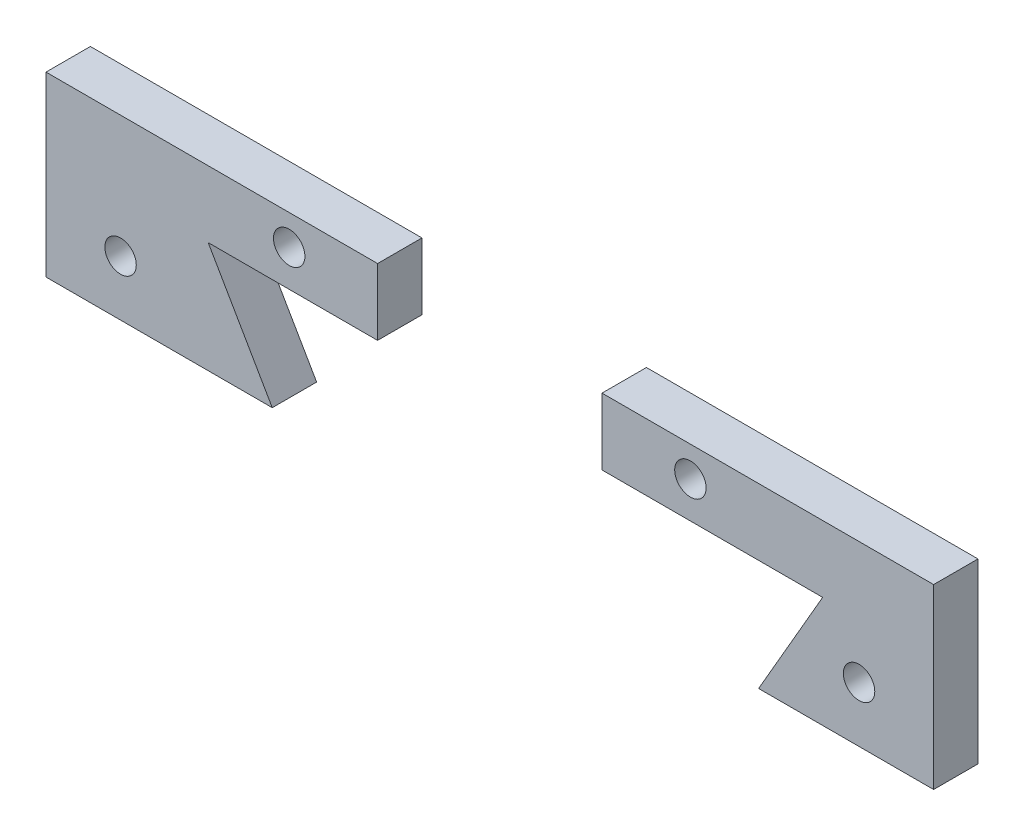
from build123d import *

# Parameters (mm, degrees)
BOSS_EXTRUDE1_DEPTH            = 6.35
BOSS_EXTRUDE1_2_DEPTH          = 6.35
SKETCH3_W                      = 2.2479
SKETCH3_H                      = 6.35
F_8_CLEARANCE_HOLE1_AT_2_COUNT = 2
F_8_CLEARANCE_HOLE1_AT_2_PITCH = 27.477896212
F_8_CLEARANCE_HOLE1_AT_3_COUNT = 2
F_8_CLEARANCE_HOLE1_AT_3_PITCH = 82.586748551
F_8_CLEARANCE_HOLE1_AT_4_COUNT = 2
F_8_CLEARANCE_HOLE1_AT_4_PITCH = 105.664


with BuildPart() as part:
    # Sketch1 → Boss-Extrude1 (new body)
    with BuildSketch(Plane.XY):
        Polygon((-31.127216058, 0), (-63.5, 0), (-63.5, 25.4), (-16.056336319, 25.4), (-16.056336319, 15.875), (-40.292651581, 15.875), align=None)
    extrude(amount=BOSS_EXTRUDE1_DEPTH)

    # Sketch3 → #8 Clearance Hole1 (revolve, cut)
    with BuildSketch(Plane(origin=(-52.832, 7.9375, 6.35), x_dir=(0, -1, 0), z_dir=(1, 0, 0))):
        with Locations((1.12395, 3.175)):
            Rectangle(SKETCH3_W, SKETCH3_H)
    f_8_clearance_hole1 = revolve(axis=Axis((-52.832, 7.9375, 12.7), (0, 0, -1)), mode=Mode.SUBTRACT)

    # #8 Clearance Hole1 at 2: #8 Clearance Hole1 ×2
    with Locations(*[Vector(0.8781603880307779, 0.4783663166378186, 0) * (i * F_8_CLEARANCE_HOLE1_AT_2_PITCH) for i in range(1, F_8_CLEARANCE_HOLE1_AT_2_COUNT)]):
        add(f_8_clearance_hole1, mode=Mode.SUBTRACT)


with BuildPart() as body_2:
    # Sketch1 → Boss-Extrude1 2 (new body)
    with BuildSketch(Plane.XY):
        Polygon((38.459564477, 0), (47.625, 15.875), (16.056336319, 15.875), (16.056336319, 25.4), (63.5, 25.4), (63.5, 0), align=None)
    extrude(amount=BOSS_EXTRUDE1_2_DEPTH)

    # #8 Clearance Hole1 at 3: #8 Clearance Hole1 ×2
    with Locations(*[Vector(0.9872528151354362, 0.1591599164587503, 0) * (i * F_8_CLEARANCE_HOLE1_AT_3_PITCH) for i in range(1, F_8_CLEARANCE_HOLE1_AT_3_COUNT)]):
        add(f_8_clearance_hole1, mode=Mode.SUBTRACT)

    # #8 Clearance Hole1 at 4: #8 Clearance Hole1 ×2
    with Locations(*[(i * F_8_CLEARANCE_HOLE1_AT_4_PITCH, 0, 0) for i in range(1, F_8_CLEARANCE_HOLE1_AT_4_COUNT)]):
        add(f_8_clearance_hole1, mode=Mode.SUBTRACT)


solid = Compound([part.part, body_2.part])
